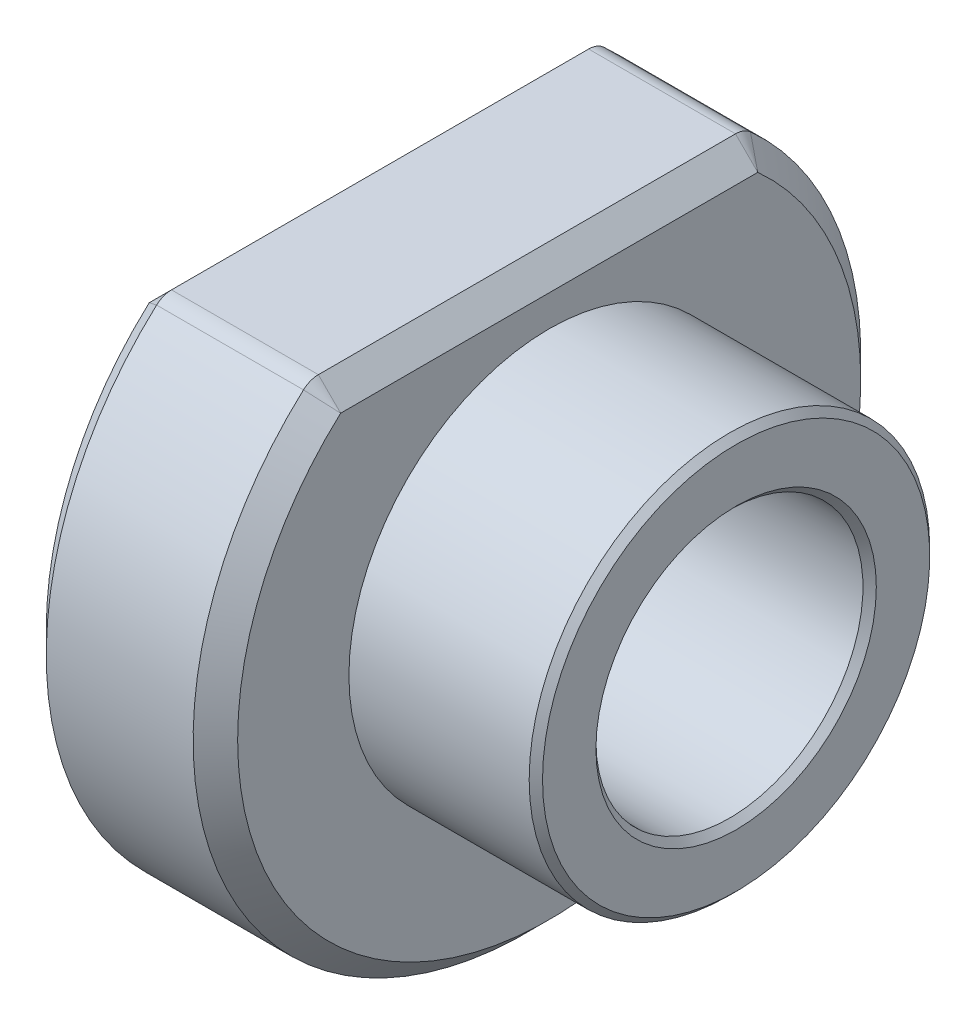
from build123d import *

# Parameters (mm, degrees)
CUT_EXTRUDE_1_REACH = 137.923
CHAMFER_2_SIZE      = 1.5
FILLET_1_R          = 5
CHAMFER_3_SIZE      = 5
CHAMFER_4_SIZE      = 2


with BuildPart() as part:
    # 草图1 → 旋转1 (revolve)
    with BuildSketch(Plane.XY, mode=Mode.PRIVATE) as revolve_1_sk:
        Polygon((0, 30), (0, 75), (43, 75), (43, 45), (85, 45), (85, 30), align=None)
    revolve(revolve_1_sk.sketch.rotate(Axis((0, 0, 0), (1, 0, 0)), 90), axis=Axis((0, 0, 0), (1, 0, 0)))

    # 草图3 → 切除-拉伸1 (cut, up to next)
    with BuildSketch(Plane.ZY, mode=Mode.PRIVATE) as cut_extrude_1_sk1:
        with BuildLine():
            Line((-48.744230428, 57), (48.744230428, 57))
            ThreePointArc((48.744230428, 57), (0, 75), (-48.744230428, 57))
        make_face()
    cut_extrude_1_tool1 = extrude(cut_extrude_1_sk1.sketch, amount=-CUT_EXTRUDE_1_REACH, mode=Mode.PRIVATE) & part.part
    add(cut_extrude_1_tool1.solids().sort_by_distance((0, 64.279608, 0))[0], mode=Mode.SUBTRACT)

    # 倒角2
    chamfer_2_edges = [part.edges().sort_by_distance(p)[0] for p in [
        (85, 0, -30),
        (85, 0, -45),
    ]]
    chamfer(chamfer_2_edges, length=CHAMFER_2_SIZE)

    # 圆角1
    fillet_1_edges = [part.edges().sort_by_distance(p)[0] for p in [
        (21.5, 57, -48.744230428),
        (21.5, 57, 48.744230428),
    ]]
    fillet(fillet_1_edges, radius=FILLET_1_R)

    # 倒角3
    chamfer_3_edges = [part.edges().sort_by_distance(p)[0] for p in [
        (43, -75, 0),
        (0, -75, 0),
        (0, 57, 0),
        (0, 56.667516929, -48.654340969),
        (0, 56.667516929, 48.654340969),
        (43, 57, 0),
        (43, 56.667516929, -48.654340969),
        (43, 56.667516929, 48.654340969),
    ]]
    chamfer(chamfer_3_edges, length=CHAMFER_3_SIZE - 0.0001)  # a hair under: the kernel refuses the full size

    # 倒角4
    chamfer_4_edges = [part.edges().sort_by_distance(p)[0] for p in [
        (0, 0, -30),
    ]]
    chamfer(chamfer_4_edges, length=CHAMFER_4_SIZE)


solid = part.part
